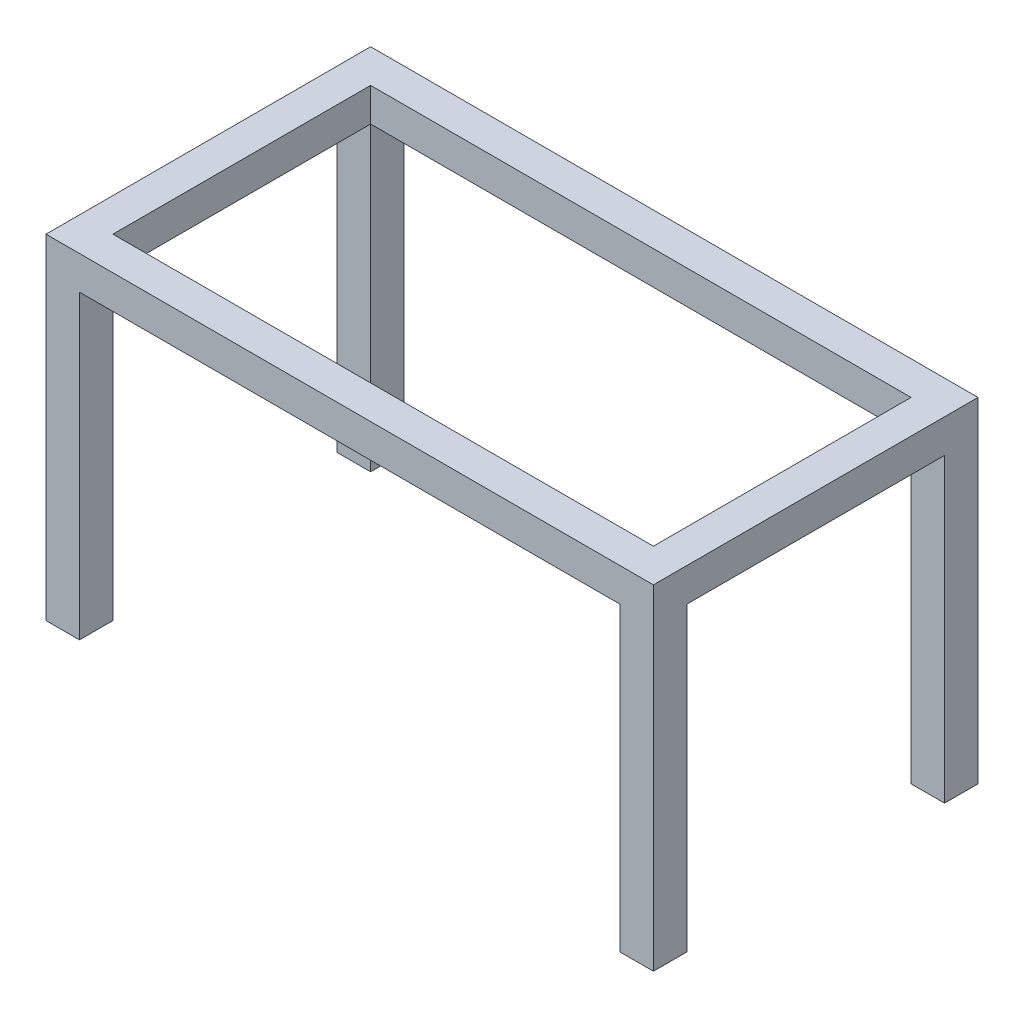
from build123d import *

# Parameters (mm, degrees)
SKETCH1_W               = 5
SKETCH1_H               = 5
BOSS_EXTRUDE1_DEPTH     = 50
BOSS_EXTRUDE1_2_DEPTH   = 50
BOSS_EXTRUDE1_3_DEPTH   = 50
BOSS_EXTRUDE1_4_DEPTH   = 50
BOSS_EXTRUDE2_OUTLINE_W = 5
BOSS_EXTRUDE2_OUTLINE_H = 5
BOSS_EXTRUDE2_DEPTH     = 80.75
SKETCH3_W               = 5
SKETCH3_H               = 5
BOSS_EXTRUDE3_DEPTH     = 38.5


# Read off the part's stored shape, not the designer's step: Boss-Extrude2
with BuildPart() as part:
    # Sketch1 → Boss-Extrude1 (new body)
    with BuildSketch(Plane(origin=(0, 0, 0), x_dir=(1, 0, 0), z_dir=(0, 1, 0))):
        with Locations((-42.875, 21.75)):
            Rectangle(SKETCH1_W, SKETCH1_H)
    extrude(amount=BOSS_EXTRUDE1_DEPTH)



with BuildPart() as body_2:
    # Sketch1 → Boss-Extrude1 2 (new body)
    with BuildSketch(Plane(origin=(0, 0, 0), x_dir=(1, 0, 0), z_dir=(0, 1, 0))):
        with Locations((-42.875, -21.75)):
            Rectangle(SKETCH1_W, SKETCH1_H)
    extrude(amount=BOSS_EXTRUDE1_2_DEPTH)


with BuildPart() as body_3:
    # Sketch1 → Boss-Extrude1 3 (new body)
    with BuildSketch(Plane(origin=(0, 0, 0), x_dir=(1, 0, 0), z_dir=(0, 1, 0))):
        with Locations((42.875, 21.75)):
            Rectangle(SKETCH1_W, SKETCH1_H)
    extrude(amount=BOSS_EXTRUDE1_3_DEPTH)


with BuildPart() as body_4:
    # Sketch1 → Boss-Extrude1 4 (new body)
    with BuildSketch(Plane(origin=(0, 0, 0), x_dir=(1, 0, 0), z_dir=(0, 1, 0))):
        with Locations((42.875, -21.75)):
            Rectangle(SKETCH1_W, SKETCH1_H)
    extrude(amount=BOSS_EXTRUDE1_4_DEPTH)


with BuildPart() as part_1:
    add(part.part)

    add(body_3.part)  # Boss-Extrude2 merges body 3
    # Boss-Extrude2 outline → Boss-Extrude2 (add)
    with BuildSketch(Plane(origin=(-40.375, 0, 0), x_dir=(0, 0, -1), z_dir=(1, 0, 0))):
        with Locations((-21.75, 47.5)):
            Rectangle(BOSS_EXTRUDE2_OUTLINE_W, BOSS_EXTRUDE2_OUTLINE_H)
        with Locations((21.75, 47.5)):
            Rectangle(BOSS_EXTRUDE2_OUTLINE_W, BOSS_EXTRUDE2_OUTLINE_H)
    extrude(amount=BOSS_EXTRUDE2_DEPTH)


    add(body_2.part)  # Boss-Extrude3 merges body 2

    add(body_4.part)  # Boss-Extrude3 merges body 4
    # Sketch3 → Boss-Extrude3 (add)
    with BuildSketch(Plane.XY.offset(-19.25)):
        with Locations((-42.875, 47.5)):
            Rectangle(SKETCH3_W, SKETCH3_H)
        with Locations((42.875, 47.5)):
            Rectangle(SKETCH3_W, SKETCH3_H)
    extrude(amount=BOSS_EXTRUDE3_DEPTH)


solid = part_1.part
